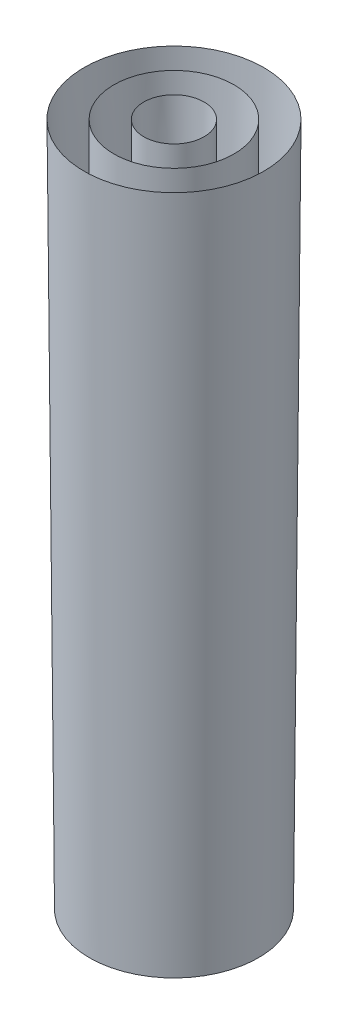
from build123d import *


with BuildPart() as part:
    # Эскиз1 → Повернуть1 (revolve)
    with BuildSketch(Plane.XY):
        Polygon((-2.624106939, 0), (3.925845078, 150), (3.925845078, 0), (10.475797094, 150), (10.475797094, 0), (17.02574911, 150), (15.859832007, 0), (15.311838216, 0), (15.852343113, 110.47254002), (11.684286956, 13.963376462), (10.989801748, -0.846269258), (10.189675666, -0.846269258), (9.467789771, 109.948786309), (4.600142305, 6.147965775), (4.258704841, -1.133064573), (3.526867258, -1.133064573), (3.220264843, 109.948786309), (-1.935686028, 0), align=None)
    revolve(axis=Axis((-2.687740891, -0.11397744, 0), (0, 1, 0)))


solid = part.part
